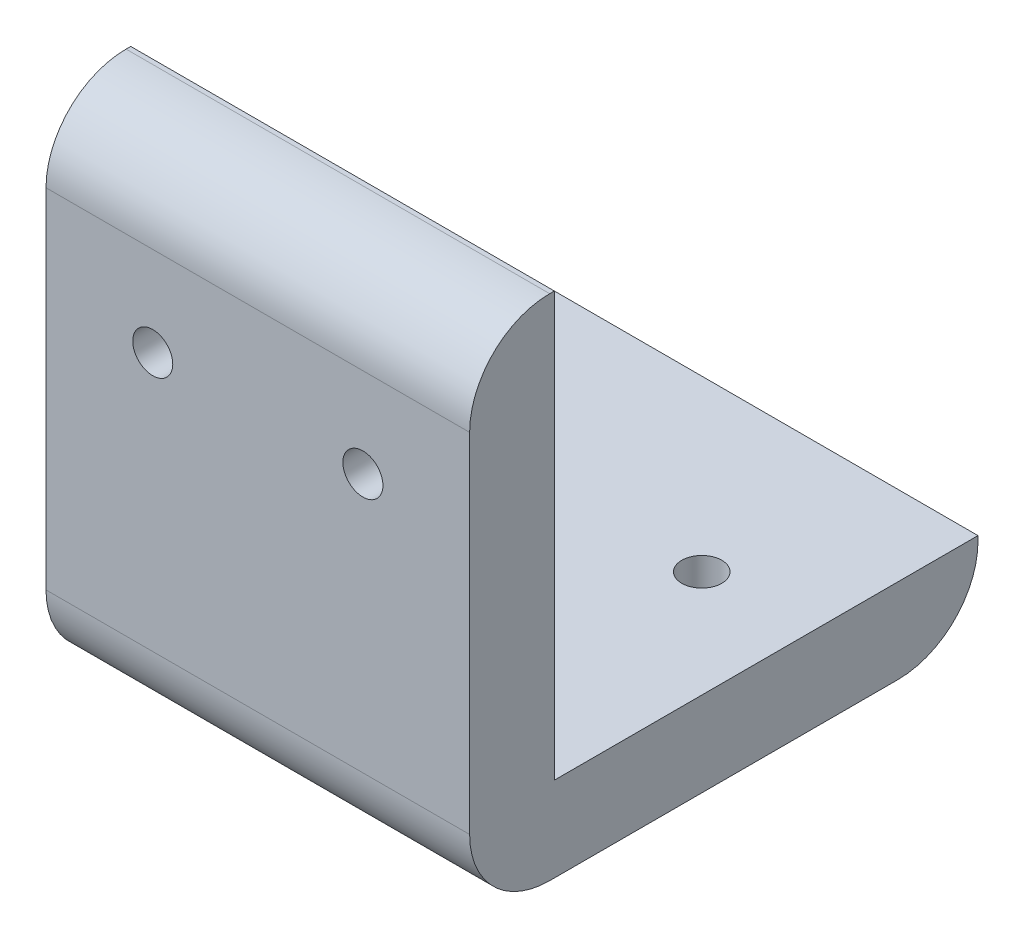
from build123d import *

# Parameters (mm, degrees)
BOSS_EXTRUDE1_DEPTH = 31.75
FILLET1_R           = 6
SKETCH2_R           = 1.5
CUT_EXTRUDE1_DEPTH  = 59.887477446
SKETCH3_R           = 1.5
CUT_EXTRUDE2_DEPTH  = 59.887477446
FILLET2_R           = 6


with BuildPart() as part:
    # Sketch1 → Boss-Extrude1 (new body)
    with BuildSketch(Plane(origin=(0, 0, 0), x_dir=(0, 0, -1), z_dir=(1, 0, 0))):
        Polygon((-6.35, 31.75), (-6.35, -6.35), (31.75, -6.35), (31.75, 0), (0, 0), (0, 31.75), align=None)
    extrude(amount=BOSS_EXTRUDE1_DEPTH)

    # Fillet1
    fillet1_edges = [part.edges().sort_by_distance(p)[0] for p in [
        (15.875, 31.75, 6.35),
        (15.875, -6.35, -31.75),
    ]]
    fillet(fillet1_edges, radius=FILLET1_R)

    # Sketch2 → Cut-Extrude1 (cut, through all)
    with BuildSketch(Plane.XY.offset(6.35)):
        with Locations((8, 19.05)):
            Circle(SKETCH2_R)
        with Locations((23.75, 19.05)):
            Circle(SKETCH2_R)
    extrude(amount=-CUT_EXTRUDE1_DEPTH, mode=Mode.SUBTRACT)

    # Sketch3 → Cut-Extrude2 (cut, through all)
    with BuildSketch(Plane.XZ.offset(6.35)):
        with Locations((8, -19.05)):
            Circle(SKETCH3_R)
        with Locations((23.75, -19.05)):
            Circle(SKETCH3_R)
    extrude(amount=-CUT_EXTRUDE2_DEPTH, mode=Mode.SUBTRACT)

    # Fillet2
    fillet2_edges = [part.edges().sort_by_distance(p)[0] for p in [
        (15.875, -6.35, 6.35),
    ]]
    fillet(fillet2_edges, radius=FILLET2_R)


solid = part.part
